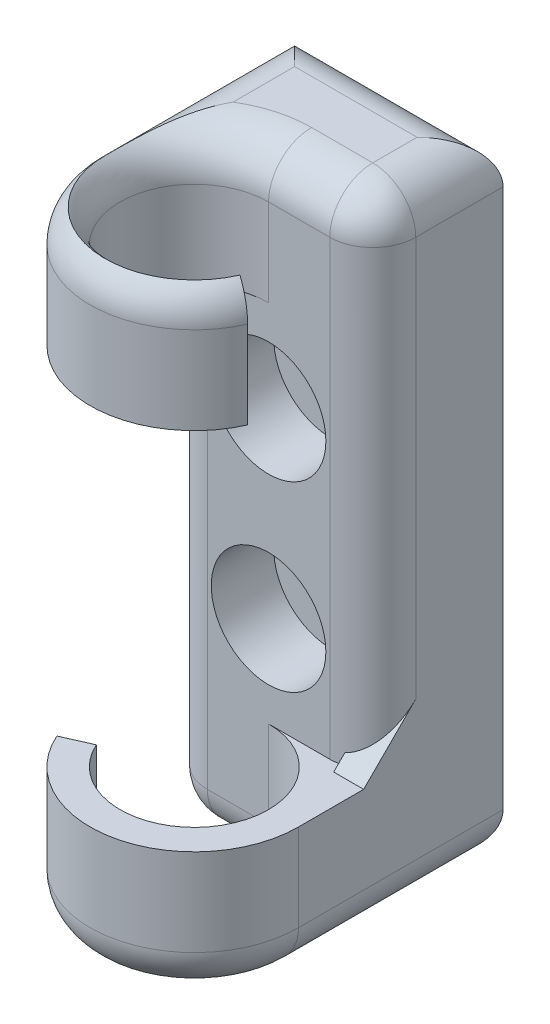
from build123d import *

# Parameters (mm, degrees)
BASE_DEPTH                                          = 5
BASE_FILLET_R                                       = 1.65
HOOK_BASE_REACH                                     = 15.601
HOOK_BASE_END_RADIUS                                = 1.65
CBORE_FOR_M2_HEX_SOCKET_HEAD_CAP_SCREW1_D           = 2.4
CBORE_FOR_M2_HEX_SOCKET_HEAD_CAP_SCREW1_DEPTH       = 7.25
CBORE_FOR_M2_HEX_SOCKET_HEAD_CAP_SCREW1_CBORE_D     = 4.4
CBORE_FOR_M2_HEX_SOCKET_HEAD_CAP_SCREW1_CBORE_DEPTH = 2.4
CBORE_FOR_M2_HEX_SOCKET_HEAD_CAP_SCREW1_TIP         = 0.7210327428330723
SKETCH16_W                                          = 5.000000000000002
SKETCH16_H                                          = 1.65
SKETCH6_W                                           = 1.1499999999999981
SKETCH6_H                                           = 2.0000000000000004
CUT_EXTRUDE4_DEPTH                                  = 7.85
CIRPATTERN1_COUNT                                   = 2
FILLET1_R                                           = 1.65


with BuildPart() as part:
    # Sketch1 → Base (new body)
    # profile 1 of 2: a face of its own
    with BuildSketch(Plane(origin=(0, 0, 0), x_dir=(0, 1, 0), z_dir=(0, 0, 1))):
        Polygon((12.000000000000002, 4), (12.000000000000004, -3.9999999999999947), (-12, -4), (-12.000000000000002, 4), align=None)
        Polygon((-10, 2.35), (10, 2.35), (10, -2.35), (-9.999999999999998, -2.35), align=None, mode=Mode.SUBTRACT)
    # profile 2 of 2: a face of its own
    with BuildSketch(Plane(origin=(0, 0, 0), x_dir=(0, 1, 0), z_dir=(0, 0, 1))):
        Polygon((10, 2.35), (10, -2.35), (-9.999999999999998, -2.35), (-10, 2.35), align=None)
    extrude(amount=BASE_DEPTH)

    # Base-Fillet
    base_fillet_edges = [part.edges().sort_by_distance(p)[0] for p in [
        (-4, 0, 5),
        (3.9999999999999973, 1.78e-15, 5),
    ]]
    fillet(base_fillet_edges, radius=BASE_FILLET_R)

    # Hook Base: up to this cylinder (the profile starts outside it)
    hook_base_end = Plane(origin=(-2.35, 9.5, 3.35), z_dir=(0, 1, 0)) * Cylinder(HOOK_BASE_END_RADIUS, 35.502, mode=Mode.PRIVATE)
    # Sketch - Hook Base → Hook Base (add, up to the surface)
    with BuildSketch(Plane.XY.offset(5), mode=Mode.PRIVATE) as hook_base_sk1:
        Polygon((-4, 12.000000000000002), (-2.850000000000002, 12.000000000000004), (-2.850000000000002, 7.000000000000002), (-3.9999999999999982, 7.000000000000002), align=None)
    hook_base_tool1 = extrude(hook_base_sk1.sketch, amount=-HOOK_BASE_REACH, mode=Mode.PRIVATE) - hook_base_end
    hook_base = hook_base_tool1.solids().sort_by_distance((-3.425, 9.5, 5))[0]
    add(hook_base)

    # Hook: sweep along a path in Hook Path
    with BuildLine(Plane(origin=(-2.6e-15, 12.000000000000004, 0), x_dir=(-1, -2.2e-16, 0), z_dir=(-2.2e-16, 1, 0))) as hook_path:
        Line((2.849999999999999, 5.000000000000002), (2.85, 7.850000000000001))
        ThreePointArc((2.85, 7.850000000000001), (0.5876262664606571, 10.638762336766174), (-2.6076809620810604, 9.000000000000002))
    # Sketch - Hook Base<3> → Hook (sweep)
    with BuildSketch(Plane.XY.offset(5)):
        Polygon((-4, 12.000000000000002), (-2.850000000000002, 12.000000000000004), (-2.850000000000002, 7.000000000000002), (-3.9999999999999982, 7.000000000000002), align=None)
    hook = sweep(path=hook_path.line)

    # CBORE for M2 Hex Socket Head Cap Screw1
    with Locations(Plane(origin=(0, 0, 5), x_dir=(0, -1, 0), z_dir=(0, 0, 1))):
        with Locations((3.5, 0), (-3.5, 0)):
            CounterBoreHole(CBORE_FOR_M2_HEX_SOCKET_HEAD_CAP_SCREW1_D / 2, CBORE_FOR_M2_HEX_SOCKET_HEAD_CAP_SCREW1_CBORE_D / 2, CBORE_FOR_M2_HEX_SOCKET_HEAD_CAP_SCREW1_CBORE_DEPTH, depth=CBORE_FOR_M2_HEX_SOCKET_HEAD_CAP_SCREW1_DEPTH)
            with Locations((0, 0, -(CBORE_FOR_M2_HEX_SOCKET_HEAD_CAP_SCREW1_DEPTH + CBORE_FOR_M2_HEX_SOCKET_HEAD_CAP_SCREW1_TIP / 2))):  # 118° drill point
                Cone(0, CBORE_FOR_M2_HEX_SOCKET_HEAD_CAP_SCREW1_D / 2, CBORE_FOR_M2_HEX_SOCKET_HEAD_CAP_SCREW1_TIP, mode=Mode.SUBTRACT)

    # Sweep1: sweep along a path in Sketch15
    with BuildLine(Plane(origin=(-2.6e-15, 12.000000000000004, 0), x_dir=(-1, -2.2e-16, 0), z_dir=(-2.2e-16, 1, 0))) as sweep1_path:
        ThreePointArc((-8.7e-16, 5), (2.0152543263816596, 5.83474567361834), (2.849999999999999, 7.85))
    # Sketch16 → Sweep1 (sweep)
    with BuildSketch(Plane.YZ):
        with Locations((9.500000000000004, 4.175)):
            Rectangle(SKETCH16_W, SKETCH16_H)
    sweep1 = sweep(path=sweep1_path.line)

    # Sweep - Hook Rib: sweep along a path in Sketch8
    with BuildLine(Plane.YZ.offset(-3.425000000000001)) as sweep_hook_rib_path:
        Line((7.000000000000002, 5.3500000000000005), (4.999999999999995, 3.35))
    # Sketch6 → Sweep - Hook Rib (sweep)
    with BuildSketch(Plane.XZ.offset(-7.000000000000002)):
        with Locations((-3.4250000000000007, 4.3500000000000005)):
            Rectangle(SKETCH6_W, SKETCH6_H)
    sweep_hook_rib = sweep(path=sweep_hook_rib_path.line)

    # Sketch19 → Cut-Extrude4 (cut)
    with BuildSketch(Plane.XY.offset(7.85)):
        Polygon((-3.999999999999999, 7.000000000000002), (-3.999999999999999, 12.000000000000004), (-4.500000000000001, 12.000000000000002), (-4.499999999999999, 7.000000000000001), align=None)
    cut_extrude4 = extrude(amount=-CUT_EXTRUDE4_DEPTH, mode=Mode.SUBTRACT)

    # CirPattern1: Hook Base, Hook, Sweep1, Sweep - Hook Rib, Cut-Extrude4 ×2 about axis
    cirpattern1_axis = Axis((-6e-16, 1.16e-15, 0), (0, 0, 1))
    add([hook_base.rotate(cirpattern1_axis, i * 360 / CIRPATTERN1_COUNT) for i in range(1, CIRPATTERN1_COUNT)])
    add([hook.rotate(cirpattern1_axis, i * 360 / CIRPATTERN1_COUNT) for i in range(1, CIRPATTERN1_COUNT)])
    add([sweep1.rotate(cirpattern1_axis, i * 360 / CIRPATTERN1_COUNT) for i in range(1, CIRPATTERN1_COUNT)])
    add([sweep_hook_rib.rotate(cirpattern1_axis, i * 360 / CIRPATTERN1_COUNT) for i in range(1, CIRPATTERN1_COUNT)])
    add([cut_extrude4.rotate(cirpattern1_axis, i * 360 / CIRPATTERN1_COUNT) for i in range(1, CIRPATTERN1_COUNT)], mode=Mode.SUBTRACT)

    # Fillet1
    # the kernel refuses this fillet: 1.65 mm, written as the material it takes off along each edge
    with BuildSketch(Plane(origin=(-3.999999999999999, -12.000000000000002, -4.125000000000005), x_dir=(1, 0, 0), z_dir=(0, 0, 1))) as fillet1_piece_1:
        with BuildLine():
            CenterArc((FILLET1_R, FILLET1_R), FILLET1_R, 179.99999999999994, 90.00000000000006)
            Line((0, FILLET1_R), (0, 0))
            Line((0, 0), (FILLET1_R, 0))
        make_face()
    extrude(amount=7.475000000000006, mode=Mode.SUBTRACT)
    with BuildSketch(Plane(origin=(3.7e-16, -12.000000000000002, 7.850000000000004), x_dir=(-0.5093397654793319, 0, -0.8605655136603251), z_dir=(0.8605655136603251, 0, -0.5093397654793319))) as fillet1_piece_2:
        with BuildLine():
            CenterArc((2.8500000000000036 + FILLET1_R, FILLET1_R), FILLET1_R, 180, 90)
            Line((2.8500000000000036, FILLET1_R), (2.8500000000000036, 0))
            Line((2.8500000000000036, 0), (2.8500000000000036 + FILLET1_R, 0))
        make_face()
    revolve(axis=Axis((3.7e-16, -12.000000000000002, 7.850000000000004), (0, 1, 0)), revolution_arc=329.3801381453189, mode=Mode.SUBTRACT)
    with BuildSketch(Plane(origin=(3.9999999999999947, 12.000000000000004, -4.125000000000001), x_dir=(-1, 0, 0), z_dir=(0, 0, 1))) as fillet1_piece_3:
        with BuildLine():
            CenterArc((FILLET1_R, FILLET1_R), FILLET1_R, 180, 90)
            Line((-8.9e-16, FILLET1_R), (0, 0))
            Line((0, 0), (FILLET1_R, 0))
        make_face()
    extrude(amount=7.475000000000001, mode=Mode.SUBTRACT)
    with BuildSketch(Plane(origin=(3.9999999999999987, -12, 7.85), x_dir=(5.4e-16, 1, 0), z_dir=(-6e-17, 0, -1))) as fillet1_piece_4:
        with BuildLine():
            CenterArc((FILLET1_R, -FILLET1_R), FILLET1_R, 89.99999999999997, 90.00000000000003)
            Line((8.9e-16, -FILLET1_R), (0, 0))
            Line((0, 0), (FILLET1_R, 0))
        make_face()
    extrude(amount=11.975000000000005, mode=Mode.SUBTRACT)
    with BuildSketch(Plane(origin=(-2.66e-15, -12.000000000000002, 5), x_dir=(0, 0, -1), z_dir=(-1, -2.2e-16, 0))) as fillet1_piece_5:
        with BuildLine():
            CenterArc((FILLET1_R, -FILLET1_R), FILLET1_R, 90, 90)
            Line((0, -FILLET1_R), (0, 0))
            Line((0, 0), (FILLET1_R, 0))
        make_face()
    extrude(amount=2.349999999999998, mode=Mode.SUBTRACT)
    with BuildSketch(Plane(origin=(-3.05e-15, 12.000000000000004, 7.850000000000004), x_dir=(0.5093397654793319, 0, -0.8605655136603251), z_dir=(-0.8605655136603251, 0, -0.5093397654793319))) as fillet1_piece_6:
        with BuildLine():
            CenterArc((2.8500000000000036 + FILLET1_R, FILLET1_R), FILLET1_R, 180, 90)
            Line((2.8500000000000036, FILLET1_R), (2.8500000000000036, 0))
            Line((2.8500000000000036, 0), (2.8500000000000036 + FILLET1_R, 0))
        make_face()
    revolve(axis=Axis((-3.05e-15, 12.000000000000004, 7.850000000000004), (0, -1, 0)), revolution_arc=329.3801381453189, mode=Mode.SUBTRACT)
    with BuildSketch(Plane(origin=(8.125, -11.999999999999998, 0), x_dir=(0, 0, 1), z_dir=(-1, -2.2e-16, 0))) as fillet1_piece_7:
        with BuildLine():
            CenterArc((FILLET1_R, FILLET1_R), FILLET1_R, 180, 90)
            Line((-2.2e-16, FILLET1_R), (0, 0))
            Line((0, 0), (FILLET1_R, 0))
        make_face()
    extrude(amount=16.25, mode=Mode.SUBTRACT)
    with BuildSketch(Plane(origin=(-8.125, 12, 0), x_dir=(0, 0, 1), z_dir=(1, 2.2e-16, 0))) as fillet1_piece_8:
        with BuildLine():
            CenterArc((FILLET1_R, FILLET1_R), FILLET1_R, 180, 90)
            Line((-2.2e-16, FILLET1_R), (0, 0))
            Line((0, 0), (FILLET1_R, 0))
        make_face()
    extrude(amount=16.249999999999993, mode=Mode.SUBTRACT)
    with BuildSketch(Plane(origin=(0, 12.000000000000004, 5), x_dir=(0, 0, -1), z_dir=(1, 2.2e-16, 0))) as fillet1_piece_9:
        with BuildLine():
            CenterArc((FILLET1_R, -FILLET1_R), FILLET1_R, 90, 90)
            Line((0, -FILLET1_R), (0, 0))
            Line((0, 0), (FILLET1_R, 0))
        make_face()
    extrude(amount=2.349999999999995, mode=Mode.SUBTRACT)
    with BuildSketch(Plane(origin=(-3.999999999999999, 12.000000000000002, -4.124999999999998), x_dir=(1, 0, 2.3e-16), z_dir=(-2.3e-16, -4.5e-16, 1))) as fillet1_piece_10:
        with BuildLine():
            CenterArc((FILLET1_R, -FILLET1_R), FILLET1_R, 90.00000000000001, 89.99999999999999)
            Line((0, -FILLET1_R), (0, 0))
            Line((0, 0), (FILLET1_R, 0))
        make_face()
    extrude(amount=11.974999999999998, mode=Mode.SUBTRACT)
    with BuildSketch(Plane(origin=(3.7e-16, -12, 7.850000000000004), x_dir=(1, 0, -1.33e-15), z_dir=(-1.33e-15, 0, -1))) as fillet1_piece_11:
        with BuildLine():
            CenterArc((3.9999999999999982 - FILLET1_R, -FILLET1_R), FILLET1_R, 6.168e-14, 89.99999999999994)
            Line((3.9999999999999982, -FILLET1_R), (3.9999999999999982, 0))
            Line((3.9999999999999982, 0), (3.9999999999999982 - FILLET1_R, 0))
        make_face()
    revolve(axis=Axis((3.7e-16, -12, 7.850000000000004), (-1.2e-16, -1, 0)), revolution_arc=215.36009714129503, mode=Mode.SUBTRACT)
    with BuildSketch(Plane(origin=(2.349999999999995, 12.000000000000004, 3.3500000000000005), x_dir=(1, 0, 0), z_dir=(0, 0, -1))) as fillet1_piece_12:
        with BuildLine():
            CenterArc((1.65 - FILLET1_R, FILLET1_R), FILLET1_R, 270, 90.00000000000001)
            Line((1.6500000000000004, FILLET1_R), (1.65, 0))
            Line((1.65, 0), (1.65 - FILLET1_R, 0))
        make_face()
    revolve(axis=Axis((2.349999999999995, 12.000000000000004, 3.3500000000000005), (2.2e-16, -1, 0)), revolution_arc=90, mode=Mode.SUBTRACT)
    with BuildSketch(Plane(origin=(-2.3500000000000005, -12, 3.3500000000000005), x_dir=(-1, 0, -2.7e-16), z_dir=(2.7e-16, 0, -1))) as fillet1_piece_13:
        with BuildLine():
            CenterArc((1.6499999999999995 - FILLET1_R, FILLET1_R), FILLET1_R, 270, 90.00000000000007)
            Line((1.6499999999999995, FILLET1_R), (1.6499999999999995, 0))
            Line((1.6499999999999995, 0), (1.6499999999999995 - FILLET1_R, -1.78e-15))
        make_face()
    revolve(axis=Axis((-2.3500000000000005, -12, 3.3500000000000005), (0, 1, 0)), revolution_arc=90, mode=Mode.SUBTRACT)
    with BuildSketch(Plane(origin=(-3.05e-15, 12.000000000000002, 7.850000000000004), x_dir=(-1, 0, -1.33e-15), z_dir=(1.33e-15, 0, -1))) as fillet1_piece_14:
        with BuildLine():
            CenterArc((3.9999999999999987 - FILLET1_R, -FILLET1_R), FILLET1_R, 0, 90)
            Line((3.9999999999999987, -FILLET1_R), (3.9999999999999987, 0))
            Line((3.9999999999999987, 0), (3.9999999999999987 - FILLET1_R, 0))
        make_face()
    revolve(axis=Axis((-3.05e-15, 12.000000000000002, 7.850000000000004), (0, 1, 0)), revolution_arc=215.36009714129503, mode=Mode.SUBTRACT)


solid = part.part
